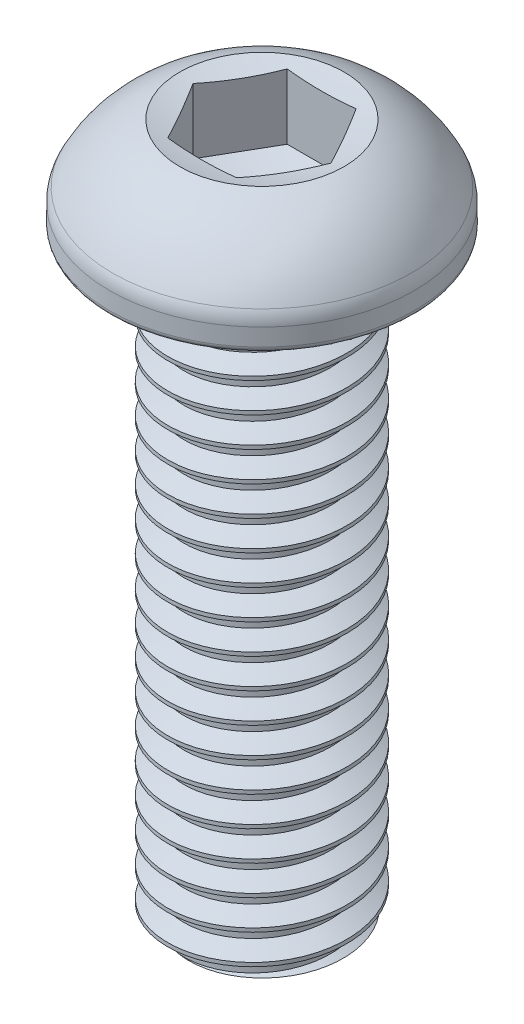
from build123d import *

# Parameters (mm, degrees)
FILLET1_R           = 0.2
FILLET2_R           = 1
SKETCH2_R           = 3
BOSS_EXTRUDE1_DEPTH = 20
THREAD1_PITCH       = 1
CUT_EXTRUDE1_DEPTH  = 2.3


with BuildPart() as part:
    # Sketch1 → Revolve1 (revolve)
    with BuildSketch(Plane.XY, mode=Mode.PRIVATE) as revolve1_sk:
        with BuildLine():
            Line((0, 0), (5.1, 0))
            Line((5.1, 0), (5.1, 1))
            ThreePointArc((5.1, 1), (4.1560785, 2.346833852), (2.75, 3.2))
            Line((2.75, 3.2), (0, 3.2))
            Line((0, 3.2), (0, 0))
        make_face()
    revolve(revolve1_sk.sketch.rotate(Axis((0, 55, 0), (0, -1, 0)), 90), axis=Axis((0, 55, 0), (0, -1, 0)))

    # Fillet1
    fillet1_edges = [part.edges().sort_by_distance(p)[0] for p in [
        (0, 0, -5.1),
    ]]
    fillet(fillet1_edges, radius=FILLET1_R)

    # Fillet2
    fillet2_edges = [part.edges().sort_by_distance(p)[0] for p in [
        (0, 1, -5.1),
    ]]
    fillet(fillet2_edges, radius=FILLET2_R)

    # Sketch2 → Boss-Extrude1 (add)
    with BuildSketch(Plane.XZ):
        with Locations(Location((0, 0, 0), (0, 0, 90))):
            Circle(SKETCH2_R)
    extrude(amount=BOSS_EXTRUDE1_DEPTH)

    # Thread1: the profile of Thread Profile1 profile screwed along a right-hand helix of 23 turns, 8 arcs to a turn; built about Z, then put on its axis
    thread1_z = Axis((0, 0, 0), (0, 0, 1))
    thread1_corners = [(3.0006, 0, -0.00034641), (3.0006, 0, 0.875346407), (2.458734125, 0, 0.562499999), (2.458734125, 0, 0.312499999)]
    with BuildLine(mode=Mode.PRIVATE) as thread1_profile:
        Line(thread1_corners[0], thread1_corners[1])
        Line(thread1_corners[1], thread1_corners[2])
        Line(thread1_corners[2], thread1_corners[3])
        Line(thread1_corners[3], thread1_corners[0])
    thread1_cap = Face(thread1_profile.wire())
    thread1_turn_angles = [0, 22.5, 45, 67.5, 90, 112.5, 135, 157.5, 180, 202.5, 225, 247.5, 270, 292.5, 315, 337.5, 360]
    thread1_turn_weights = [1, 0.9238795325112867, 1, 0.9238795325112867, 1, 0.9238795325112867, 1, 0.9238795325112867, 1, 0.9238795325112867, 1, 0.9238795325112867, 1, 0.9238795325112867, 1, 0.9238795325112867, 1]
    thread1_turn_rails = [Edge.make_bspline([Vector(p[0], p[1], 0).rotate(thread1_z, thread1_turn_angles[k]) / thread1_turn_weights[k] + Vector(0, 0, p[2] + THREAD1_PITCH * thread1_turn_angles[k] / 360) for k in range(17)], [0, 0, 0, 1, 1, 2, 2, 3, 3, 4, 4, 5, 5, 6, 6, 7, 7, 8, 8, 8], 2, thread1_turn_weights) for p in thread1_corners]
    thread1_turn_sides = [Face.make_surface_from_curves(thread1_turn_rails[p[0]], thread1_turn_rails[p[1]]) for p in [(0, 1), (1, 2), (2, 3), (3, 0)]]
    thread1 = Plane(origin=(0, -22, 0), x_dir=(1, 0, 0), z_dir=(0, 1, 0)) * Solid(Shell([*[p.moved(Location((0, 0, THREAD1_PITCH * i))) for i in range(23) for p in thread1_turn_sides], thread1_cap, thread1_cap.rotate(thread1_z, 8280).moved(Location((0, 0, THREAD1_PITCH * 8280 / 360)))]))
    add(thread1, mode=Mode.SUBTRACT)

    # Sketch6 → Revolve2 (revolve)
    with BuildSketch(Plane.XY, mode=Mode.PRIVATE) as revolve2_sk:
        Polygon((0, 0), (0, 3.2), (2.75, 3.2), (4.9, 0), align=None)
    revolve(revolve2_sk.sketch.rotate(Axis((0, 55, 0), (0, -1, 0)), 90), axis=Axis((0, 55, 0), (0, -1, 0)))

    # Sketch7 → Cut-Extrude1 (cut)
    with BuildSketch(Plane(origin=(0, 3.2, 0), x_dir=(1, 0, 0), z_dir=(0, 1, 0))):
        Polygon((1.154700538, -2), (2.309401077, 0), (1.154700538, 2), (-1.154700538, 2), (-2.309401077, 0), (-1.154700538, -2), align=None)
    extrude(amount=-CUT_EXTRUDE1_DEPTH, mode=Mode.SUBTRACT)

    # Sketch8 → Cut-Revolve1 (revolve, cut)
    with BuildSketch(Plane.XY, mode=Mode.PRIVATE) as cut_revolve1_sk:
        with BuildLine():
            Line((0, 0.9), (0, 0.5))
            Line((0, 0.5), (0.25, 0.5))
            ThreePointArc((0.25, 0.5), (1.298943849, 0.600925763), (2.309401077, 0.9))
            Line((2.309401077, 0.9), (0, 0.9))
        make_face()
    revolve(cut_revolve1_sk.sketch.rotate(Axis((0, 55, 0), (0, -1, 0)), 90), axis=Axis((0, 55, 0), (0, -1, 0)), mode=Mode.SUBTRACT)

    # Sketch9 → Cut-Revolve2 (revolve, cut)
    with BuildSketch(Plane.XY, mode=Mode.PRIVATE) as cut_revolve2_sk:
        with BuildLine():
            ThreePointArc((0, 2.814442262), (1.388448304, 2.911300775), (2.75, 3.2))
            Line((2.75, 3.2), (0, 3.2))
            Line((0, 3.2), (0, 2.814442262))
        make_face()
    revolve(cut_revolve2_sk.sketch.rotate(Axis((0, 55, 0), (0, -1, 0)), 90), axis=Axis((0, 55, 0), (0, -1, 0)), mode=Mode.SUBTRACT)

    # Sketch10 → Cut-Revolve3 (revolve, cut)
    with BuildSketch(Plane.XY, mode=Mode.PRIVATE) as cut_revolve3_sk:
        Polygon((3, -19.6), (3, -20), (2.4, -20), align=None)
    revolve(cut_revolve3_sk.sketch.rotate(Axis((0, 55, 0), (0, -1, 0)), 90), axis=Axis((0, 55, 0), (0, -1, 0)), mode=Mode.SUBTRACT)


solid = part.part
